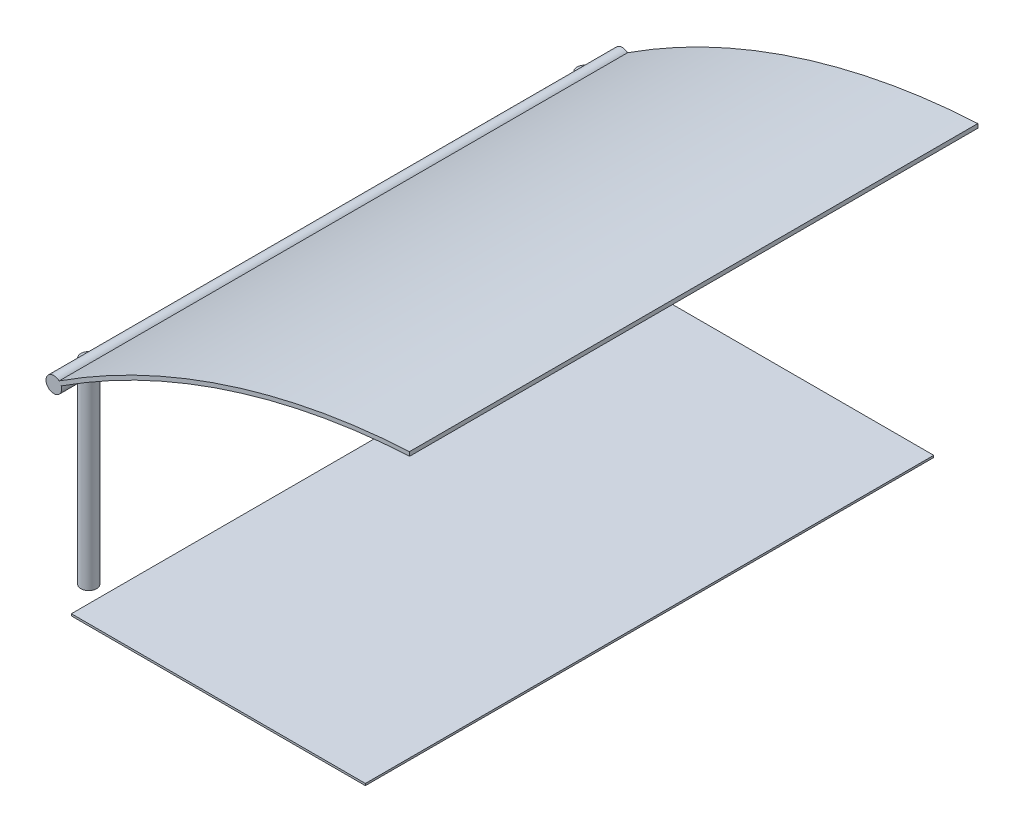
from build123d import *

# Parameters (mm, degrees)
SKETCH1_W           = 7500
SKETCH1_H           = 14500
BOSS_EXTRUDE1_DEPTH = 50
SKETCH2_W           = 2295.209370317
SKETCH2_H           = 2155.478040844
BOSS_EXTRUDE2_DEPTH = 200
BOSS_EXTRUDE6_DEPTH = 14500
SKETCH7_R           = 200
BOSS_EXTRUDE7_DEPTH = 14500
FLEX1_START         = -7250
FLEX1_DEPTH         = 14500
FLEX1_2_DEPTH       = 14500
SKETCH8_R           = 200
BOSS_EXTRUDE8_DEPTH = 5000


# Read off the part's stored shape, not the designer's step: Flex1
with BuildPart() as part:
    # Sketch1 → Boss-Extrude1 (new body)
    with BuildSketch(Plane(origin=(0, 0, 0), x_dir=(1, 0, 0), z_dir=(0, 1, 0))):
        Rectangle(SKETCH1_W, SKETCH1_H)
    extrude(amount=BOSS_EXTRUDE1_DEPTH)


with BuildPart() as body_2:
    # Sketch2 → Boss-Extrude2 (new body)
    with BuildSketch(Plane(origin=(0, 0, 0), x_dir=(1, 0, 0), z_dir=(0, 1, 0))):
        with Locations((-5179.735671531, 3873.557041916)):
            Rectangle(SKETCH2_W, SKETCH2_H)
    extrude(amount=BOSS_EXTRUDE2_DEPTH)


with BuildPart() as body_3:
    # Sketch6 → Boss-Extrude6 (new body)
    with BuildSketch(Plane.XY.offset(7250)):
        Polygon((-4004.312581595, 4958.453202823), (3972.037258969, 10299.161598928), (3916.400449414, 10382.255193281), (-4059.94939115, 5041.546797177), align=None)
    extrude(amount=-BOSS_EXTRUDE6_DEPTH)

    # Flex1 outline → Flex1 (cut)
    with BuildSketch(Plane.XY.offset(FLEX1_START)):
        with BuildLine():
            Line((-4059.94939115, 5041.546797177), (-4058.940612826, 5040.040186399))
            ThreePointArc((-4058.940612826, 5040.040186399), (-3357.212748232, 5473.322169875), (-2636.526368855, 5874.279045028))
            Line((-2636.526368855, 5874.279045028), (3972.037258969, 10299.161598928))
            Line((3972.037258969, 10299.161598928), (3916.400449414, 10382.255193281))
            Line((3916.400449414, 10382.255193281), (-4059.94939115, 5041.546797177))
        make_face()
    extrude(amount=FLEX1_DEPTH, mode=Mode.SUBTRACT)

    # Flex1 2 outline → Flex1 2 (add)
    with BuildSketch(Plane.XY.offset(FLEX1_START)):
        with BuildLine():
            ThreePointArc((-4058.940612826, 5040.040186399), (-4060.02023341, 5039.339149017), (-4061.099804272, 5038.638035066))
            Line((-4061.099804272, 5038.638035066), (-4006.631154417, 4954.77406078))
            ThreePointArc((-4006.631154417, 4954.77406078), (246.188836109, 6983.560594539), (4879.186092901, 7842.507094583))
            Line((4879.186092901, 7842.507094583), (4873.94684556, 7942.369751704))
            ThreePointArc((4873.94684556, 7942.369751704), (1006.447894186, 7316.016056247), (-2636.526368855, 5874.279045028))
            Line((-2636.526368855, 5874.279045028), (-4004.312581595, 4958.453202823))
            Line((-4004.312581595, 4958.453202823), (-4058.940612826, 5040.040186399))
        make_face()
    extrude(amount=FLEX1_2_DEPTH)



with BuildPart() as body_4:
    # Sketch7 → Boss-Extrude7 (new body)
    with BuildSketch(Plane.XY.offset(7250)):
        with Locations((-4198.318175079, 4888.72638089)):
            Circle(SKETCH7_R)
    extrude(amount=-BOSS_EXTRUDE7_DEPTH)


with BuildPart() as body_3_1:
    add(body_3.part)

    add(body_4.part)  # Boss-Extrude8 merges body 4
    # Sketch8 → Boss-Extrude8 (add)
    with BuildSketch(Plane(origin=(0, 5000, 0), x_dir=(1, 0, 0), z_dir=(0, 1, 0))):
        with Locations(Location((-4229.708989675, 6328.376755088, 0), (0, 0, 270))):
            Circle(SKETCH8_R)
        with Locations(Location((-4229.708989675, -6328.376755088, 0), (0, 0, 227.62486357))):
            Circle(SKETCH8_R)
    extrude(amount=-BOSS_EXTRUDE8_DEPTH)


solid = Compound([part.part, body_2.part, body_3_1.part])
